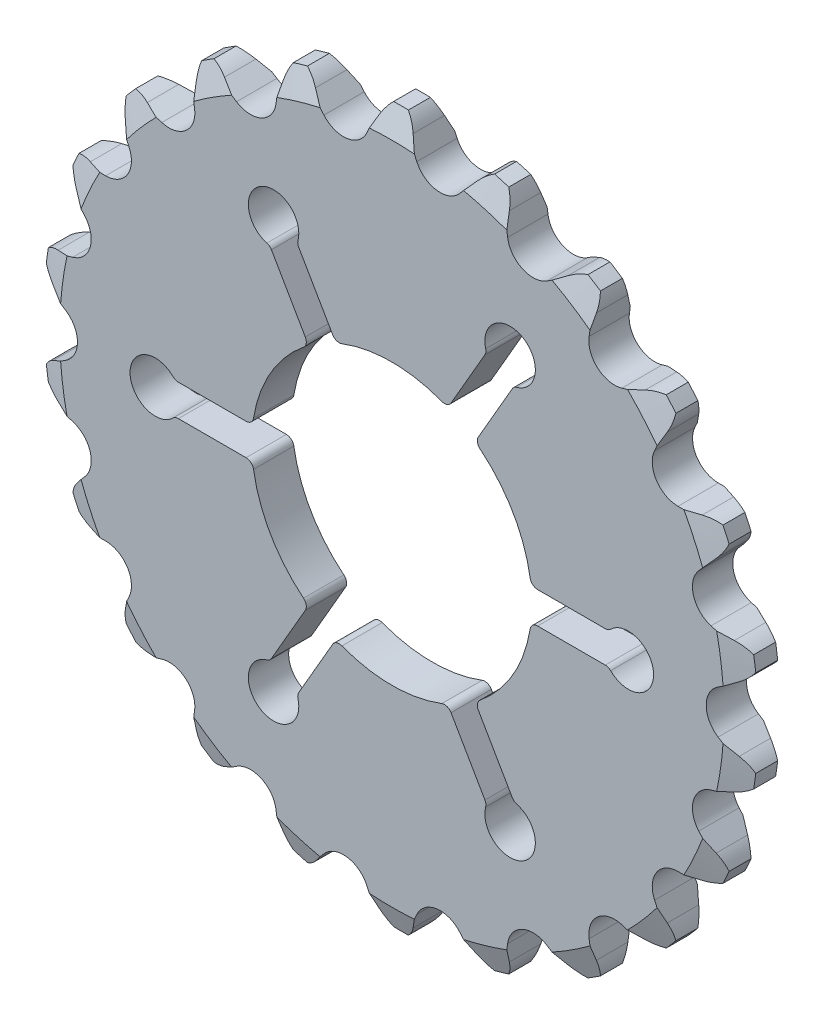
from build123d import *

# Parameters (mm, degrees)
SKETCH1_R                = 35.98
EXTRUDE1_DEPTH           = 2.03
CHAMFER1_SIZE            = 2.54
CHAMFER1_SIZE2           = 0.9244843950361562
CHAMFER2_SIZE            = 2.54
CHAMFER2_SIZE2           = 0.9244843950361562
EXTRUDE2_DEPTH           = 51.923881431014266
CIRPATTERN1_COUNT        = 22
EXTRUDE3_REACH           = 52.857
SKETCH4_R                = 14.1
EXTRUDE4_REACH           = 52.857
FILLET1_R                = 0.762
CIRPATTERN6_COUNT        = 6
FILLET1_OF_CIRPATTERN6_R = 0.762


with BuildPart() as part:
    # Sketch1 → Extrude1 (new, symmetric)
    with BuildSketch(Plane.XY):
        Circle(SKETCH1_R)
    extrude(amount=EXTRUDE1_DEPTH, both=True)

    # Chamfer1
    chamfer1_edges = [part.edges().sort_by_distance(p)[0] for p in [
        (-35.98, 4.41e-15, -2.03),
    ]]
    chamfer1_side = [part.faces().sort_by_distance(p)[0] for p in [
        (-1.421e-14, -1.69e-15, -2.03),
    ]]
    chamfer(chamfer1_edges, length=CHAMFER1_SIZE, length2=CHAMFER1_SIZE2, reference=chamfer1_side[0])

    # Chamfer2
    chamfer2_edges = [part.edges().sort_by_distance(p)[0] for p in [
        (-35.98, 4.41e-15, 2.03),
    ]]
    chamfer2_side = [part.faces().sort_by_distance(p)[0] for p in [
        (-1.421e-14, -1.69e-15, 2.03),
    ]]
    chamfer(chamfer2_edges, length=CHAMFER2_SIZE, length2=CHAMFER2_SIZE2, reference=chamfer2_side[0])

    # Sketch3 → Extrude2 (cut, symmetric)
    with BuildSketch(Plane(origin=(0, 0, 0), x_dir=(-1, 0, 0), z_dir=(0, 0, -1))):
        with BuildLine():
            Line((2.512451922258281, 32.82355403711645), (1.6945739997631863, 34.63114287173395))
            ThreePointArc((1.6945739997631863, 34.63114287173395), (1.283881959988971, 35.34734893970503), (0.7443853515239898, 35.97229893193423))
            ThreePointArc((0.7443853515239898, 35.97229893193423), (5.120487881072798, 35.61377547887596), (9.420335239109232, 34.724885658311344))
            ThreePointArc((9.420335239109232, 34.724885658311344), (8.726623274789464, 34.277244290817094), (8.130788581551858, 33.70575491937878))
            Line((8.130788581551858, 33.70575491937878), (6.8367838375485865, 32.20180897166798))
            ThreePointArc((6.8367838375485865, 32.20180897166798), (4.504162988449899, 31.327141693636868), (2.512451922258281, 32.82355403711645))
        make_face()
    extrude2 = extrude(amount=EXTRUDE2_DEPTH, both=True, mode=Mode.SUBTRACT)

    # CirPattern1: Extrude2 ×22 about axis
    cirpattern1_axis = Axis((0, 0, 1.105515604963845), (0, 0, -1))
    for i in range(1, CIRPATTERN1_COUNT):
        add(extrude2.rotate(cirpattern1_axis, i * 360 / CIRPATTERN1_COUNT), mode=Mode.SUBTRACT)

    # Sketch4 → Extrude3 (cut, up to next)
    with BuildSketch(Plane(origin=(0, 0, -2.03), x_dir=(-1, 0, 0), z_dir=(0, 0, -1)), mode=Mode.PRIVATE) as extrude3_sk1:
        Circle(SKETCH4_R)
    extrude3_tool1 = extrude(extrude3_sk1.sketch, amount=-EXTRUDE3_REACH, mode=Mode.PRIVATE) & part.part
    add(extrude3_tool1.solids().sort_by_distance((0, 0, -2.03))[0], mode=Mode.SUBTRACT)

    # Sketch5 → Extrude4 (cut, up to next)
    with BuildSketch(Plane(origin=(0, 0, -2.03), x_dir=(-1, 0, 0), z_dir=(0, 0, -1)), mode=Mode.PRIVATE) as extrude4_sk1:
        with BuildLine():
            Line((12.289671896262014, 18.111336132677202), (8.281065328507788, 11.168225889772566))
            Line((8.281065328507788, 11.168225889772566), (5.531434671492206, 12.755725889772558))
            Line((5.531434671492206, 12.755725889772558), (9.540041239246438, 19.69883613267719))
            ThreePointArc((9.540041239246438, 19.69883613267719), (13.176249999999992, 22.82193445322943), (12.289671896262014, 18.111336132677202))
        make_face()
    extrude4_tool1 = extrude(extrude4_sk1.sketch, amount=-EXTRUDE4_REACH, mode=Mode.PRIVATE) & part.part
    extrude4 = extrude4_tool1.solids().sort_by_distance((-10.223201, 17.707104, -2.03))[0]
    add(extrude4, mode=Mode.SUBTRACT)

    # Fillet1
    fillet1_edges = [part.edges().sort_by_distance(p)[0] for p in [
        (-12.289671896262014, 18.111336132677202, 0),
        (-8.379989197691906, 11.339567057280759, 0),
        (-5.630358540676324, 12.927067057280748, 0),
        (-9.540041239246438, 19.69883613267719, 0),
    ]]
    fillet(fillet1_edges, radius=FILLET1_R)

    # CirPattern6: Extrude4 ×6 about axis
    cirpattern6_axis = Axis((0, 0, 1.105515604963845), (0, 0, -1))
    for i in range(1, CIRPATTERN6_COUNT):
        add(extrude4.rotate(cirpattern6_axis, i * 360 / CIRPATTERN6_COUNT), mode=Mode.SUBTRACT)

    # Fillet1 of CirPattern6
    fillet1_of_cirpattern6_edges = [part.edges().sort_by_distance(p)[0] for p in [
        (9.540041239246458, 19.69883613267718, 0),
        (5.630358540676334, 12.927067057280746, 0),
        (8.379989197691911, 11.339567057280753, 0),
        (12.289671896262032, 18.111336132677188, 0),
        (21.829713135508474, 1.5874999999999826, 0),
        (14.010347738368239, 1.5874999999999906, 0),
        (14.010347738368237, -1.587499999999995, 0),
        (21.829713135508474, -1.5874999999999986, 0),
        (12.289671896262016, -18.111336132677202, 0),
        (8.379989197691907, -11.339567057280757, 0),
        (5.630358540676326, -12.927067057280748, 0),
        (9.54004123924644, -19.69883613267719, 0),
        (-9.54004123924645, -19.698836132677187, 0),
        (-5.630358540676328, -12.927067057280748, 0),
        (-8.379989197691907, -11.339567057280753, 0),
        (-12.289671896262025, -18.111336132677195, 0),
        (-21.829713135508477, -1.5874999999999755, 0),
        (-14.010347738368242, -1.5874999999999861, 0),
        (-14.010347738368237, 1.5874999999999995, 0),
        (-21.829713135508474, 1.587500000000004, 0),
    ]]
    fillet(fillet1_of_cirpattern6_edges, radius=FILLET1_OF_CIRPATTERN6_R)


solid = part.part
